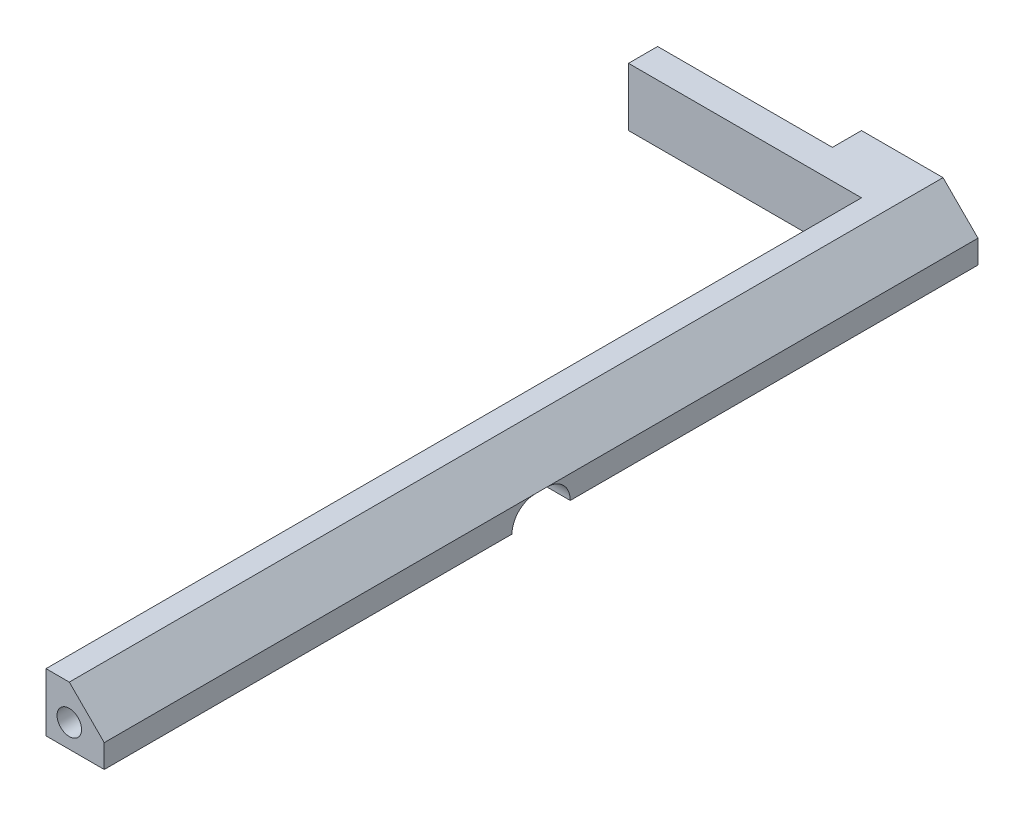
from build123d import *

# Parameters (mm, degrees)
DODANIE_WYCI_GNI_CIE1_DEPTH = 10
SZKIC2_R                    = 2.1
WYTNIJ_WYCI_GNI_CIE1_DEPTH  = 4
SZKIC3_R                    = 2.1
WYTNIJ_WYCI_GNI_CIE2_DEPTH  = 4
SFAZOWANIE1_SIZE            = 6
SZKIC4_W                    = 10
SZKIC4_H                    = 10
WYTNIJ_WYCI_GNI_CIE3_DEPTH  = 4
ZAOKR_GLENIE1_R             = 4


with BuildPart() as part:
    # Szkic1 → Dodanie-wyciągnięcie1 (new body)
    with BuildSketch(Plane(origin=(0, 0, 0), x_dir=(1, 0, 0), z_dir=(0, 1, 0))):
        Polygon((0, 0), (0, 150), (-20, 150), (-20, 145), (-50, 145), (-50, 140), (-10, 140), (-10, 0), align=None)
    extrude(amount=DODANIE_WYCI_GNI_CIE1_DEPTH)

    # Szkic2 → Wytnij-wyciągnięcie1 (cut)
    with BuildSketch(Plane.XZ):
        with Locations(Location((-7.2, -123, 0), (0, 0, 270))):
            Circle(SZKIC2_R)
        with Locations(Location((-7.2, -27, 0), (0, 0, 270))):
            Circle(SZKIC2_R)
    extrude(amount=-WYTNIJ_WYCI_GNI_CIE1_DEPTH, mode=Mode.SUBTRACT)

    # Szkic3 → Wytnij-wyciągnięcie2 (cut)
    with BuildSketch(Plane.XY):
        with Locations((-6, 4)):
            Circle(SZKIC3_R)
    extrude(amount=-WYTNIJ_WYCI_GNI_CIE2_DEPTH, mode=Mode.SUBTRACT)

    # Sfazowanie1
    sfazowanie1_edges = [part.edges().sort_by_distance(p)[0] for p in [
        (0, 10, -75),
    ]]
    chamfer(sfazowanie1_edges, length=SFAZOWANIE1_SIZE)

    # Szkic4 → Wytnij-wyciągnięcie3 (cut)
    with BuildSketch(Plane.XZ):
        with Locations((-5, -75)):
            Rectangle(SZKIC4_W, SZKIC4_H)
    extrude(amount=-WYTNIJ_WYCI_GNI_CIE3_DEPTH, mode=Mode.SUBTRACT)

    # Zaokrąglenie1
    zaokr_glenie1_edges = [part.edges().sort_by_distance(p)[0] for p in [
        (-5, 4, -80),
        (-5, 4, -70),
    ]]
    fillet(zaokr_glenie1_edges, radius=ZAOKR_GLENIE1_R - 0.0001)  # a hair under: the kernel refuses the full size


solid = part.part
